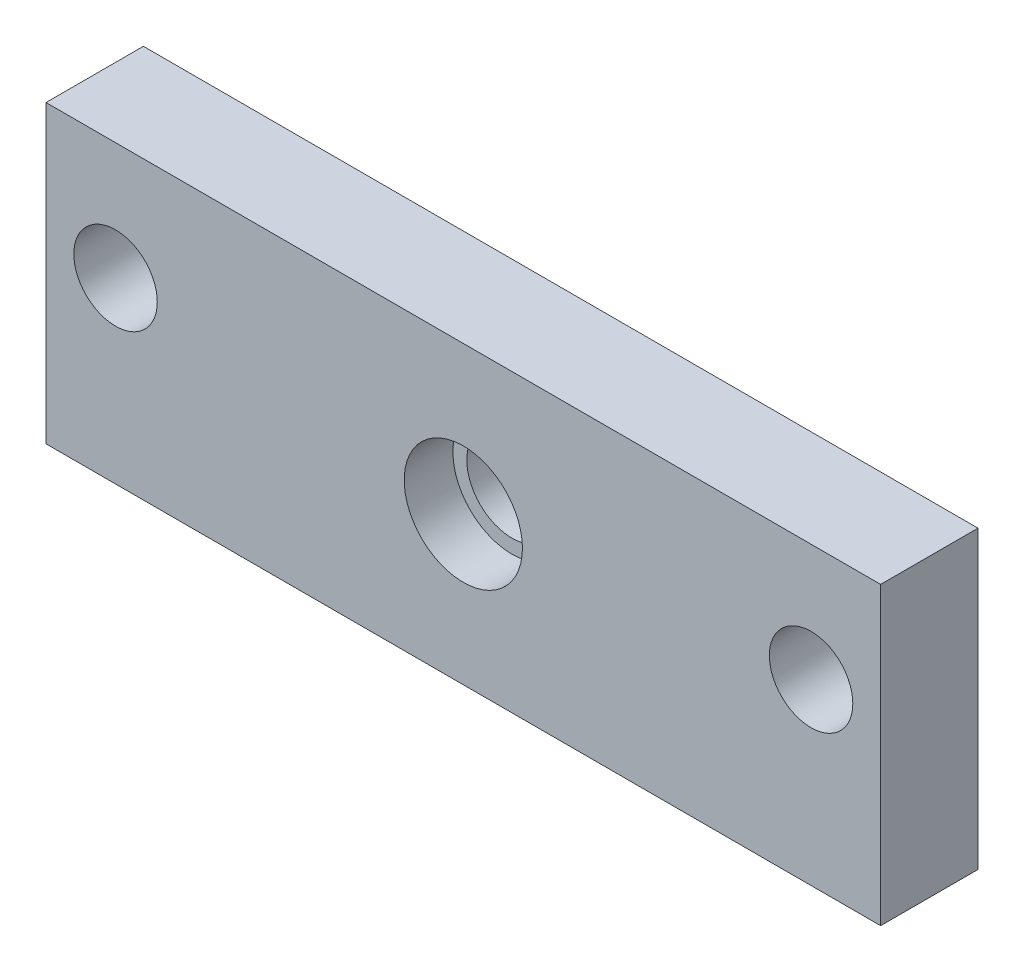
from build123d import *

# Parameters (mm, degrees)
SKETCH1_W           = 120
SKETCH1_H           = 42.5
BOSS_EXTRUDE1_DEPTH = 7
SKETCH2_R           = 8.5
CUT_EXTRUDE1_DEPTH  = 7
SKETCH3_R           = 6.5
CUT_EXTRUDE2_DEPTH  = 65.035634611
SKETCH5_R           = 6
CUT_EXTRUDE4_DEPTH  = 66.173326599
SKETCH6_R           = 2.5
SKETCH6_R_2         = 1.25
CUT_EXTRUDE5_DEPTH  = 10


with BuildPart() as part:
    # Sketch1 → Boss-Extrude1 (new, symmetric)
    with BuildSketch(Plane.XY):
        Rectangle(SKETCH1_W, SKETCH1_H)
    extrude(amount=BOSS_EXTRUDE1_DEPTH, both=True)

    # Sketch2 → Cut-Extrude1 (cut)
    with BuildSketch(Plane.XY.offset(7)):
        Circle(SKETCH2_R)
    extrude(amount=-CUT_EXTRUDE1_DEPTH, mode=Mode.SUBTRACT)

    # Sketch3 → Cut-Extrude2 (cut, through all)
    with BuildSketch(Plane.XY):
        Circle(SKETCH3_R)
    extrude(amount=-CUT_EXTRUDE2_DEPTH, mode=Mode.SUBTRACT)

    # Sketch5 → Cut-Extrude4 (cut, through all)
    with BuildSketch(Plane.XY.offset(7)):
        with Locations((-50, 4.4)):
            Circle(SKETCH5_R)
        with Locations((50, 4.4)):
            Circle(SKETCH5_R)
    extrude(amount=-CUT_EXTRUDE4_DEPTH, mode=Mode.SUBTRACT)

    # Sketch6 → Cut-Extrude5 (cut)
    with BuildSketch(Plane.XZ.offset(21.25)):
        with Locations((-50, 0)):
            Circle(SKETCH6_R)
        with Locations((-25, 0)):
            Circle(SKETCH6_R)
        with Locations((25, 0)):
            Circle(SKETCH6_R)
        with Locations((50, 0)):
            Circle(SKETCH6_R)
        with Locations((-37.5, 0)):
            Circle(SKETCH6_R_2)
        with Locations((37.5, 0)):
            Circle(SKETCH6_R_2)
    extrude(amount=-CUT_EXTRUDE5_DEPTH, mode=Mode.SUBTRACT)


solid = part.part
